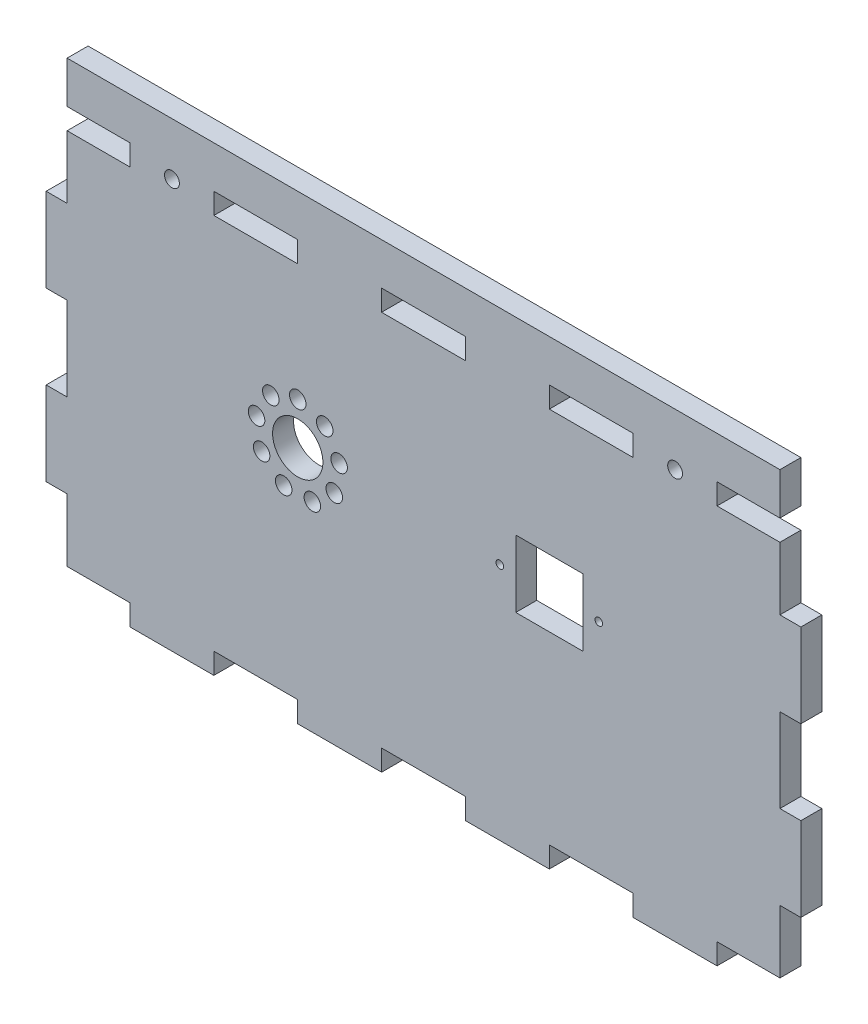
from build123d import *

# Parameters (mm, degrees)
SKETCH1_W                 = 228.6
SKETCH1_H                 = 139.7
BOSS_EXTRUDE1_DEPTH       = 6.35
SKETCH5_W                 = 6.35
SKETCH5_H                 = 25.4
CUT_EXTRUDE4_DEPTH        = 6.35
SKETCH6_W                 = 25.4
SKETCH6_H                 = 6.35
CUT_EXTRUDE5_DEPTH        = 6.35
LPATTERN5_COUNT           = 3
LPATTERN5_PITCH           = 50.8
LPATTERN5_COUNT_DIR2      = 2
LPATTERN5_PITCH_DIR2      = 222.25
LPATTERN6_COUNT           = 5
LPATTERN6_PITCH           = 50.8
LPATTERN6_COUNT_DIR2      = 2
LPATTERN6_PITCH_DIR2      = 120.65
SKETCH7_W                 = 6.35
SKETCH7_H                 = 19.05
CUT_EXTRUDE6_DEPTH        = 6.35
SKETCH8_W                 = 6.35
SKETCH8_H                 = 19.05
CUT_EXTRUDE7_DEPTH        = 6.35
F_8_CLEARANCE_HOLE1_D     = 4.4958
F_8_CLEARANCE_HOLE1_DEPTH = 10.16
F_8_CLEARANCE_HOLE1_TIP   = 1.350674586
SKETCH11_R                = 1.143
SKETCH11_W                = 20.32
SKETCH11_H                = 20.32
CUT_EXTRUDE8_DEPTH        = 7.62
SKETCH12_R                = 7.62
CUT_EXTRUDE9_DEPTH        = 7.62
SKETCH13_R                = 2.5
CUT_EXTRUDE10_DEPTH       = 7.62


with BuildPart() as part:
    # Sketch1 → Boss-Extrude1 (new body)
    with BuildSketch(Plane.XY):
        with Locations((114.3, 69.85)):
            Rectangle(SKETCH1_W, SKETCH1_H)
    extrude(amount=BOSS_EXTRUDE1_DEPTH)

    # Sketch5 → Cut-Extrude4 (cut)
    with BuildSketch(Plane.XY.offset(6.35)):
        with Locations((3.175, 12.7)):
            Rectangle(SKETCH5_W, SKETCH5_H)
    cut_extrude4 = extrude(amount=-CUT_EXTRUDE4_DEPTH, mode=Mode.SUBTRACT)

    # Sketch6 → Cut-Extrude5 (cut)
    with BuildSketch(Plane.XY.offset(6.35)):
        with Locations((12.7, 3.175)):
            Rectangle(SKETCH6_W, SKETCH6_H)
    cut_extrude5 = extrude(amount=-CUT_EXTRUDE5_DEPTH, mode=Mode.SUBTRACT)

    # LPattern5: Cut-Extrude4 3 × 2
    with Locations(*[(j * LPATTERN5_PITCH_DIR2, i * LPATTERN5_PITCH, 0) for i in range(LPATTERN5_COUNT) for j in range(LPATTERN5_COUNT_DIR2) if (i, j) != (0, 0)]):
        add(cut_extrude4, mode=Mode.SUBTRACT)

    # LPattern6: Cut-Extrude5 5 × 2
    with Locations(*[(i * LPATTERN6_PITCH, j * LPATTERN6_PITCH_DIR2, 0) for i in range(LPATTERN6_COUNT) for j in range(LPATTERN6_COUNT_DIR2) if (i, j) != (0, 0)]):
        add(cut_extrude5, mode=Mode.SUBTRACT)

    # Sketch7 → Cut-Extrude6 (cut)
    with BuildSketch(Plane.XY.offset(6.35)):
        with Locations((3.175, 130.175)):
            Rectangle(SKETCH7_W, SKETCH7_H)
    extrude(amount=-CUT_EXTRUDE6_DEPTH, mode=Mode.SUBTRACT)

    # Sketch8 → Cut-Extrude7 (cut)
    with BuildSketch(Plane.XY.offset(6.35)):
        with Locations((225.425, 130.175)):
            Rectangle(SKETCH8_W, SKETCH8_H)
    extrude(amount=-CUT_EXTRUDE7_DEPTH, mode=Mode.SUBTRACT)

    # #8 Clearance Hole1
    with Locations(Plane.XY.offset(6.35)):
        with Locations((38.1, 123.825), (190.5, 123.825)):
            Hole(F_8_CLEARANCE_HOLE1_D / 2, depth=F_8_CLEARANCE_HOLE1_DEPTH)
            with Locations((0, 0, -(F_8_CLEARANCE_HOLE1_DEPTH + F_8_CLEARANCE_HOLE1_TIP / 2))):  # 118° drill point
                Cone(0, F_8_CLEARANCE_HOLE1_D / 2, F_8_CLEARANCE_HOLE1_TIP, mode=Mode.SUBTRACT)

    # Sketch11 → Cut-Extrude8 (cut)
    with BuildSketch(Plane.XY.offset(6.35)):
        with Locations((137.414, 72.39)):
            Circle(SKETCH11_R)
        with Locations((167.386, 72.39)):
            Circle(SKETCH11_R)
        with Locations((152.4, 72.39)):
            Rectangle(SKETCH11_W, SKETCH11_H)
    extrude(amount=-CUT_EXTRUDE8_DEPTH, mode=Mode.SUBTRACT)

    # Sketch12 → Cut-Extrude9 (cut)
    with BuildSketch(Plane.XY.offset(6.35)):
        with Locations((76.2, 72.39)):
            Circle(SKETCH12_R)
    extrude(amount=-CUT_EXTRUDE9_DEPTH, mode=Mode.SUBTRACT)

    # Sketch13 → Cut-Extrude10 (cut)
    with BuildSketch(Plane.XY.offset(6.35)):
        with Locations((76.2, 85.09)):
            Circle(SKETCH13_R)
        with Locations((84.373925913, 82.147676874)):
            Circle(SKETCH13_R)
        with Locations((88.744227587, 74.639628293)):
            Circle(SKETCH13_R)
        with Locations((87.2659923, 66.078953633)):
            Circle(SKETCH13_R)
        with Locations((80.63090277, 60.471287707)):
            Circle(SKETCH13_R)
        with Locations((71.943591129, 60.440519725)):
            Circle(SKETCH13_R)
        with Locations((65.268947043, 66.001046367)):
            Circle(SKETCH13_R)
        with Locations((63.730110661, 74.551035419)):
            Circle(SKETCH13_R)
        with Locations((68.047120627, 82.089851982)):
            Circle(SKETCH13_R)
    extrude(amount=-CUT_EXTRUDE10_DEPTH, mode=Mode.SUBTRACT)


solid = part.part
